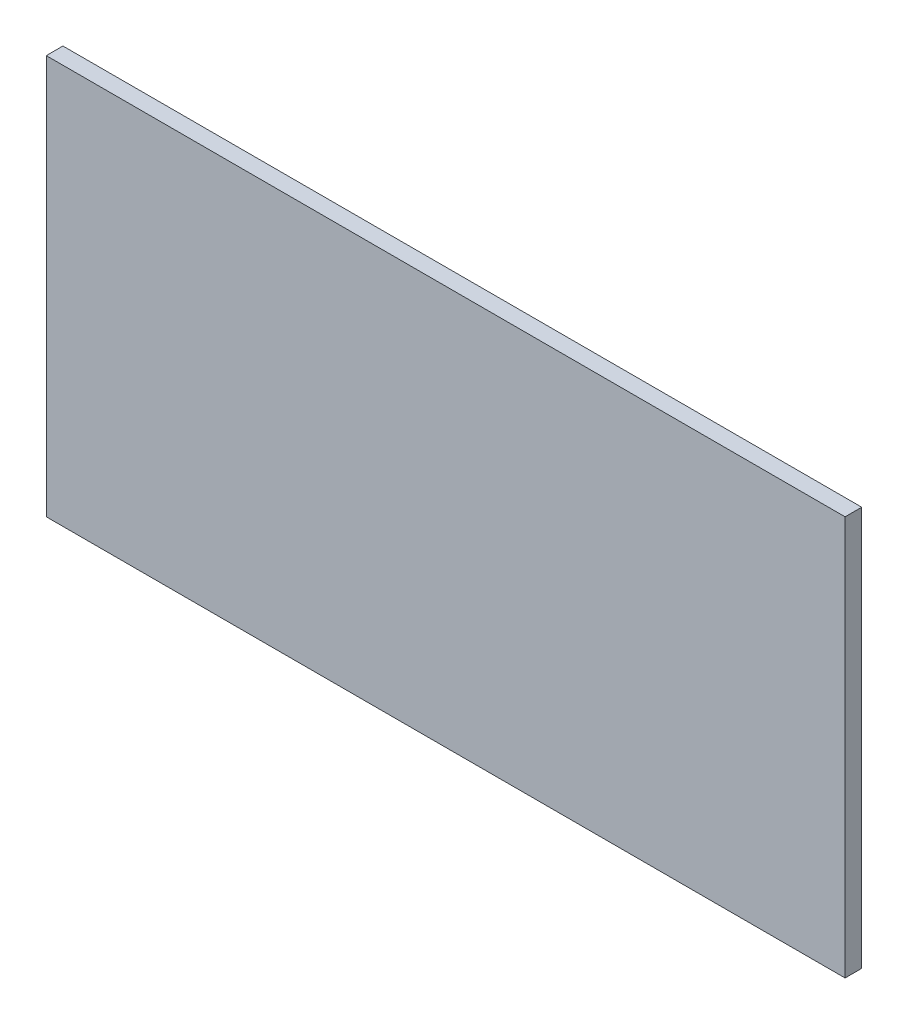
from build123d import *

# Parameters (mm, degrees)
SKETCH1_W           = 304.8
SKETCH1_H           = 304.8
BOSS_EXTRUDE1_DEPTH = 12.7
SKETCH2_W           = 12.7
SKETCH2_H           = 304.8
BOSS_EXTRUDE2_DEPTH = 304.8


with BuildPart() as part:
    # Sketch1 → Boss-Extrude1 (new body)
    with BuildSketch(Plane.XY):
        with Locations((-60.739130435, 60.186956522)):
            Rectangle(SKETCH1_W, SKETCH1_H)
    extrude(amount=BOSS_EXTRUDE1_DEPTH)

    # Sketch2 → Boss-Extrude2 (add)
    with BuildSketch(Plane.ZY.offset(213.139130435)):
        with Locations((6.35, 60.186956522)):
            Rectangle(SKETCH2_W, SKETCH2_H)
    extrude(amount=BOSS_EXTRUDE2_DEPTH)


solid = part.part
